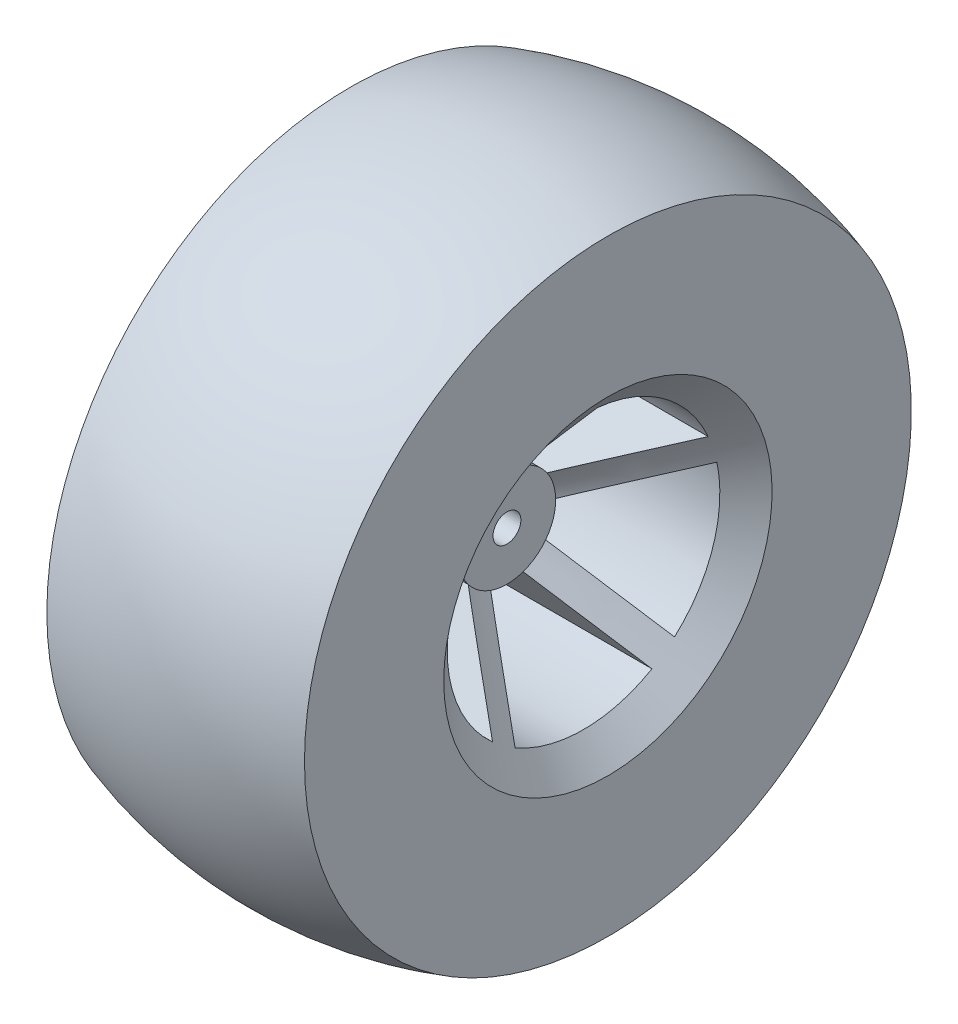
from build123d import *

# Parameters (mm, degrees)
CUT_EXTRUDE1_DEPTH      = 69.313615204
CUT_EXTRUDE1_DEPTH_BACK = 69.313615204


with BuildPart() as part:
    # Sketch1 → Revolve1 (revolve)
    with BuildSketch(Plane(origin=(0, 0, 0), x_dir=(1, 0, 0), z_dir=(0, 1, 0))):
        with BuildLine():
            Line((18.5, -43.576702778), (18.5, -23.576702778))
            Line((18.5, -23.576702778), (4, -7))
            Line((4, -7), (4, -2))
            Line((4, -2), (0, -2))
            Line((0, -2), (0, -46.5))
            ThreePointArc((0, -46.5), (9.364769974, -45.764669773), (18.5, -43.576702778))
        make_face()
    revolve(axis=Axis((-21.521301372, 0, 0), (1, 0, 0)))

    # Mirror1: part across plane


with BuildPart() as part_1:
    add(part.part)
    add(part.part.mirror(Plane(origin=(0, 0, 2), x_dir=(0, 0, 1), z_dir=(-1, 0, 0))))

    # Sketch2 → Cut-Extrude1 (cut, two sides: drawn at the far end of the back side and taken through both)
    with BuildSketch(Plane(origin=(0, 0, 0), x_dir=(0, 0, -1), z_dir=(1, 0, 0)).offset(-CUT_EXTRUDE1_DEPTH_BACK)):
        with BuildLine():
            Line((2, 19.474272558), (2, 6.708203932))
            ThreePointArc((2, 6.708203932), (4.114496766, 5.663118961), (5.761847074, 3.975062049))
            Line((5.761847074, 3.975062049), (17.903099827, 7.919994206))
            ThreePointArc((17.903099827, 7.919994206), (11.506897181, 15.837885241), (2, 19.474272558))
        make_face()
        with BuildLine():
            ThreePointArc((-5.761847074, 3.975062049), (-4.114496766, 5.663118961), (-2, 6.708203932))
            Line((-2, 6.708203932), (-2, 19.474272558))
            ThreePointArc((-2, 19.474272558), (-11.506897181, 15.837885241), (-17.903099827, 7.919994206))
            Line((-17.903099827, 7.919994206), (-5.761847074, 3.975062049))
        make_face()
        with BuildLine():
            Line((19.139167805, 4.115768141), (6.997915051, 0.170835984))
            ThreePointArc((6.997915051, 0.170835984), (6.657395614, -2.163118961), (5.56101733, -4.251480479))
            Line((5.56101733, -4.251480479), (13.064724197, -14.579446948))
            ThreePointArc((13.064724197, -14.579446948), (18.618550745, -6.049533852), (19.139167805, 4.115768141))
        make_face()
        with BuildLine():
            Line((9.82865622, -16.930587957), (2.324949352, -6.602621488))
            ThreePointArc((2.324949352, -6.602621488), (0, -7), (-2.324949352, -6.602621488))
            Line((-2.324949352, -6.602621488), (-9.82865622, -16.930587957))
            ThreePointArc((-9.82865622, -16.930587957), (0, -19.576702778), (9.82865622, -16.930587957))
        make_face()
        with BuildLine():
            Line((-13.064724197, -14.579446948), (-5.56101733, -4.251480479))
            ThreePointArc((-5.56101733, -4.251480479), (-6.657395614, -2.163118961), (-6.997915051, 0.170835984))
            Line((-6.997915051, 0.170835984), (-19.139167805, 4.115768141))
            ThreePointArc((-19.139167805, 4.115768141), (-18.618550745, -6.049533852), (-13.064724197, -14.579446948))
        make_face()
    extrude(amount=CUT_EXTRUDE1_DEPTH + CUT_EXTRUDE1_DEPTH_BACK, mode=Mode.SUBTRACT)


solid = part_1.part
